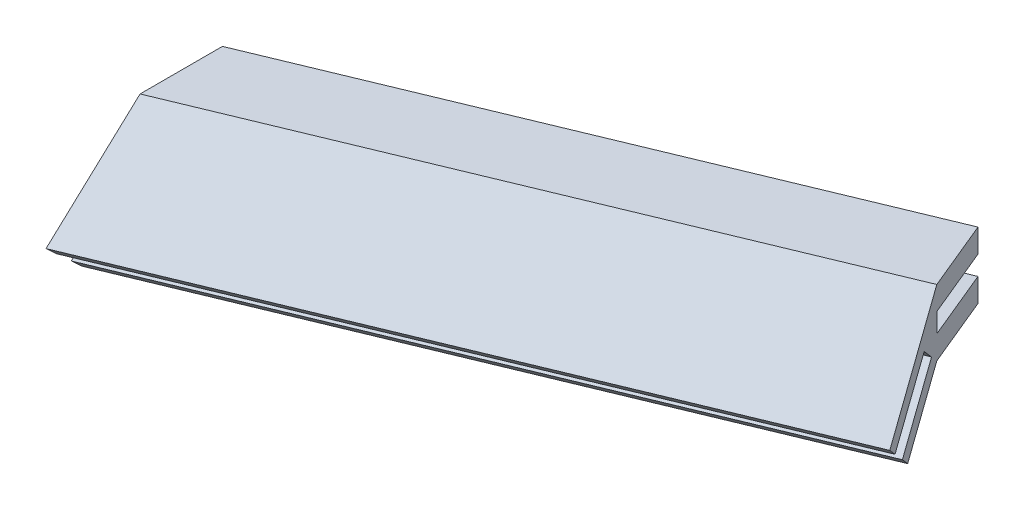
from build123d import *

# Parameters (mm, degrees)
SKETCH1_W           = 214.089522673
SKETCH1_H           = 271.033566845
BOSS_EXTRUDE1_DEPTH = 10
SKETCH3_W           = 107.044761337
SKETCH3_H           = 271.033566845
CUT_EXTRUDE1_DEPTH  = 252.253590179
CUT_EXTRUDE2_DEPTH  = 249.55642867
BOSS_EXTRUDE3_DEPTH = 40
CUT_EXTRUDE3_START  = -165.689856025
CUT_EXTRUDE3_DEPTH  = 205.862728092
CUT_EXTRUDE4_DEPTH  = 250.960593361
CUT_EXTRUDE5_DEPTH  = 250.960593361
CUT_EXTRUDE11_DEPTH = 252.67545035
SKETCH26_W          = 104.148686
SKETCH26_H          = 11.3
BOSS_EXTRUDE7_DEPTH = 45
CUT_EXTRUDE12_DEPTH = 250.816831154
CUT_EXTRUDE13_DEPTH = 252.67545035
CUT_EXTRUDE14_DEPTH = 237.436663672


with BuildPart() as part:
    # Sketch1 → Boss-Extrude1 (new body)
    with BuildSketch(Plane(origin=(0, 0, 0), x_dir=(1, 0, 0), z_dir=(0, 1, 0))):
        with Locations((-3.148375333, -90.062114546)):
            Rectangle(SKETCH1_W, SKETCH1_H)
    extrude(amount=BOSS_EXTRUDE1_DEPTH)

    # Sketch3 → Cut-Extrude1 (cut, through all)
    with BuildSketch(Plane(origin=(0, 10, 0), x_dir=(1, 0, 0), z_dir=(0, 1, 0))):
        with Locations((-56.670756002, -90.062114546)):
            Rectangle(SKETCH3_W, SKETCH3_H)
    extrude(amount=-CUT_EXTRUDE1_DEPTH, mode=Mode.SUBTRACT)

    # Sketch4 → Cut-Extrude2 (cut, through all)
    with BuildSketch(Plane(origin=(0, 10, 0), x_dir=(1, 0, 0), z_dir=(0, 1, 0))):
        Polygon((103.896386003, -181.239506042), (100.834918545, -173.848469781), (9.996584241, 45.454668877), (103.896386003, 45.454668877), align=None)
    extrude(amount=-CUT_EXTRUDE2_DEPTH, mode=Mode.SUBTRACT)

    # Sketch6 → Boss-Extrude3 (add, along a direction that is not the sketch's normal)
    with BuildSketch(Plane(origin=(0, 10, 0), x_dir=(1, 0, 0), z_dir=(0, 1, 0))):
        Polygon((99.572063218, -170.799667324), (103.896386003, -181.239506042), (-3.148375333, -225.578897968), (-3.148375333, -213.347866105), align=None)
    extrude(amount=BOSS_EXTRUDE3_DEPTH, dir=(-0.2705980500730979, 0.7071067811865489, -0.6532814824381872))

    # Cut-Extrude3: read off the stored shape, not the designer's step
    # Cut-Extrude3 outline → Cut-Extrude3 (cut)
    with BuildSketch(Plane(origin=(0, 0, 0), x_dir=(1, 0, 0), z_dir=(0, 0.6785983445458481, -0.7345095552677544)).offset(CUT_EXTRUDE3_START)):
        Polygon((-3.148375333, -165), (-3.148375333, -152.122604304), (-13.972297336, -155.165042499), (-15, -155.45391393), (-15, -165), align=None)
    extrude(amount=CUT_EXTRUDE3_DEPTH, mode=Mode.SUBTRACT)

    # Sketch8 → Cut-Extrude4 (cut, through all)
    with BuildSketch(Plane(origin=(0, 10, 0), x_dir=(1, 0, 0), z_dir=(0, 1, 0))):
        Polygon((-3.148375333, -225.578897968), (103.896386003, -181.239506042), (103.896386003, -225.578897968), align=None)
    extrude(amount=-CUT_EXTRUDE4_DEPTH, mode=Mode.SUBTRACT)

    # Sketch9 → Cut-Extrude5 (cut, through all)
    with BuildSketch(Plane(origin=(0, 10, 0), x_dir=(1, 0, 0), z_dir=(0, 1, 0))):
        Polygon((-3.148375333, -213.347866105), (99.572063218, -170.799667324), (9.996584241, 45.454668877), (-3.148375333, 45.454668877), align=None)
    extrude(amount=-CUT_EXTRUDE5_DEPTH, mode=Mode.SUBTRACT)

    # Sketch25 → Cut-Extrude11 (cut, through all)
    with BuildSketch(Plane(origin=(24.603270673, 0, -10.191008392), x_dir=(-0.38268343236508967, 0, -0.9238795325112868), z_dir=(0.9238795325112867, 0, -0.3826834323650896))):
        Polygon((-178.918624473, 38.284271247), (-178.918624473, 26.984271247), (-167.618624473, 38.284271247), align=None)
    extrude(amount=-CUT_EXTRUDE11_DEPTH, mode=Mode.SUBTRACT)

    # Sketch26 → Boss-Extrude7 (add)
    with BuildSketch(Plane(origin=(68.469193327, 0, 165.299255136), x_dir=(-0.9238795325112868, 0, 0.3826834323650896), z_dir=(-0.38268343236508956, 0, -0.9238795325112867))):
        with Locations((25.443954722, 32.634271247)):
            Rectangle(SKETCH26_W, SKETCH26_H)
    extrude(amount=BOSS_EXTRUDE7_DEPTH)

    # Sketch27 → Cut-Extrude12 (cut, through all)
    with BuildSketch(Plane.XZ.offset(-26.984271247)):
        Polygon((-3.148375333, 194.964223379), (-3.148375333, 146.256574366), (-20.36912979, 153.389644416), align=None)
    extrude(amount=-CUT_EXTRUDE12_DEPTH, mode=Mode.SUBTRACT)

    # Sketch29 → Cut-Extrude13 (cut, through all)
    with BuildSketch(Plane(origin=(24.603270673, 0, -10.191008392), x_dir=(-0.38268343236508967, 0, -0.9238795325112868), z_dir=(0.9238795325112867, 0, -0.3826834323650896))):
        Polygon((-188.111012628, 17.791883092), (-189.772713564, 19.453584028), (-180.580325409, 28.645972183), (-182.906923537, 30.972570312), (-192.099311693, 21.780182156), (-193.761012628, 23.441883092), (-207.20289572, 10), (-207.20289572, 0), (-195.90289572, 0), (-195.90289572, 10), align=None)
    extrude(amount=-CUT_EXTRUDE13_DEPTH, mode=Mode.SUBTRACT)

    # Sketch31 → Cut-Extrude14 (cut, through all)
    with BuildSketch(Plane(origin=(24.603270673, 0, -10.191008392), x_dir=(-0.38268343236508967, 0, -0.9238795325112868), z_dir=(0.9238795325112867, 0, -0.3826834323650896))):
        Polygon((-133.918624473, 38.284271247), (-165.918624473, 38.284271247), (-165.918624473, 34.284271247), (-178.918624473, 34.284271247), (-178.918624473, 30.984271247), (-165.918624473, 30.984271247), (-165.918624473, 26.984271247), (-133.918624473, 26.984271247), align=None)
    extrude(amount=-CUT_EXTRUDE14_DEPTH, mode=Mode.SUBTRACT)


solid = part.part
